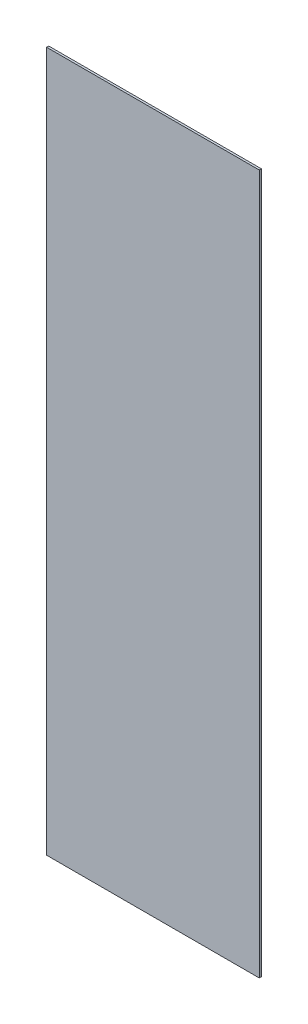
from build123d import *

# Parameters (mm, degrees)
SKETCH_1_W      = 10
SKETCH_1_H      = 32.9
EXTRUDE_1_DEPTH = 0.1


with BuildPart() as part:
    # Эскиз1 → Бобышка-Вытянуть1 (new body)
    with BuildSketch(Plane.XY):
        with Locations((18.5, 0)):
            Rectangle(SKETCH_1_W, SKETCH_1_H)
    extrude(amount=EXTRUDE_1_DEPTH)


solid = part.part
